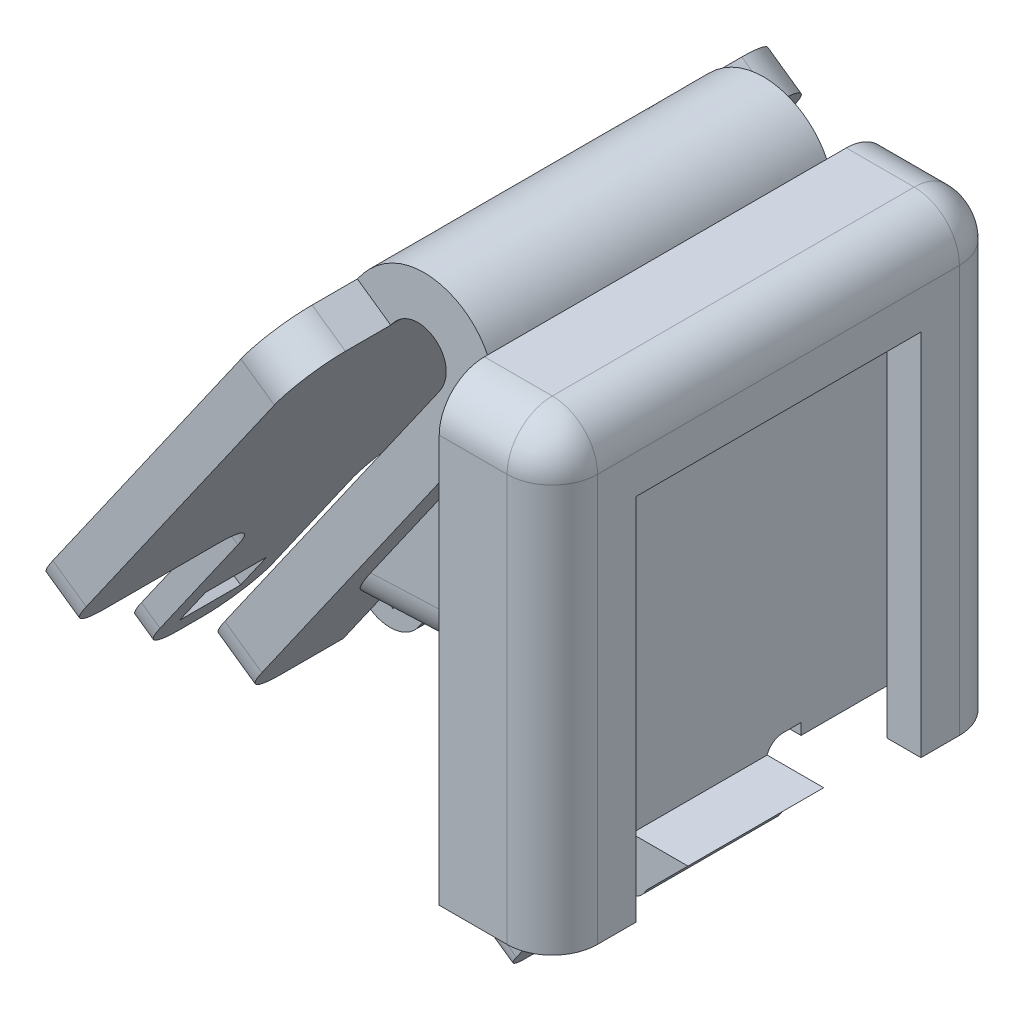
from build123d import *

# Parameters (mm, degrees)
BOSS_EXTRUDE1_DEPTH      = 1.5
FILLET7_R                = 0.75
BOSS_EXTRUDE2_DEPTH      = 2
BOSS_EXTRUDE3_DEPTH      = 1.5
BOSS_EXTRUDE5_DEPTH      = 3
BOSS_EXTRUDE5_DEPTH_BACK = 3
BOSS_EXTRUDE4_DEPTH      = 7.5
BOSS_EXTRUDE4_DEPTH_BACK = 7.5
BOSS_EXTRUDE6_DEPTH      = 1.8
BOSS_EXTRUDE7_DEPTH      = 15
SKETCH18_W               = 1
SKETCH18_H               = 5.5
CUT_EXTRUDE2_DEPTH       = 5
FILLET8_R                = 2
SKETCH14_W               = 2.5
SKETCH14_H               = 1
BOSS_EXTRUDE9_DEPTH      = 1.15
SKETCH16_W               = 2.5
SKETCH16_H               = 3
BOSS_EXTRUDE11_DEPTH     = 1
SKETCH15_W               = 5
SKETCH15_H               = 10
SKETCH15_W_2             = 2.7
SKETCH15_H_2             = 2
BOSS_EXTRUDE10_DEPTH     = 1
FILLET2_R                = 1
FILLET3_R                = 2
FILLET4_R                = 2
FILLET5_R                = 1.55


with BuildPart() as part:
    # Sketch1 → Boss-Extrude1 (new body)
    with BuildSketch(Plane(origin=(0, 0, 0), x_dir=(0, 0, -1), z_dir=(1, 0, 0))):
        Polygon((-10, -10), (-10, 10), (10, 10), (10, -10), (4.5, -10), (4.5, -9.5), (3, -9.5), (3, -10), (-3, -10), (-3, -9.5), (-4.5, -9.5), (-4.5, -10), align=None)
    extrude(amount=BOSS_EXTRUDE1_DEPTH)

    # Fillet7
    # the kernel refuses this fillet: 0.75 mm, written as the material it adds along each edge
    with BuildSketch(Plane(origin=(0, -9.5, -3), x_dir=(0, 0, -1), z_dir=(1, 0, 0))) as fillet7_piece_1:
        with BuildLine():
            CenterArc((0.707106781, -0.75), FILLET7_R, 90, 70.528779366)
            Line((0, -0.5), (-0.014142136, -0.495))
            ThreePointArc((-0.014142136, -0.495), (-0.015, -0.25), (-0.015, 0))
            Line((-0.015, 0), (0, 0.015))
            Line((0, 0.015), (0.707106781, 0.015))
            Line((0.707106781, 0.015), (0.707106781, 0))
        make_face()
    extrude(amount=1.5)
    with BuildSketch(Plane(origin=(0, -9.5, 3), x_dir=(0, -1, 0), z_dir=(1, 0, 0))) as fillet7_piece_2:
        with BuildLine():
            CenterArc((0.75, -0.707106781), FILLET7_R, 109.471220634, 70.528779366)
            Line((0, -0.707106781), (-0.015, -0.707106781))
            Line((-0.015, -0.707106781), (-0.015, 0))
            Line((-0.015, 0), (0, 0.015))
            ThreePointArc((0, 0.015), (0.25, 0.015), (0.495, 0.014142136))
            Line((0.495, 0.014142136), (0.5, 0))
        make_face()
    extrude(amount=1.5)

    # Sketch3 → Boss-Extrude2 (add)
    with BuildSketch(Plane(origin=(1.5, 0, 0), x_dir=(0, 0, -1), z_dir=(1, 0, 0))):
        Polygon((-10, 10), (-10, -10), (-8.5, -10), (-8.5, 8.5), (8.5, 8.5), (8.5, -10), (10, -10), (10, 10), align=None)
    extrude(amount=BOSS_EXTRUDE2_DEPTH)

    # Sketch5 → Boss-Extrude3 (add)
    with BuildSketch(Plane(origin=(3.5, 0, 0), x_dir=(0, 0, -1), z_dir=(1, 0, 0))):
        Polygon((-10, 10), (-10, -10), (-6.3, -10), (-6.3, 6.3), (6.3, 6.3), (6.3, -10), (10, -10), (10, 10), align=None)
    extrude(amount=BOSS_EXTRUDE3_DEPTH)

    # Sketch9 → Boss-Extrude5 (add, two sides: drawn at the far end of the back side and taken through both)
    with BuildSketch(Plane.XY.offset(-BOSS_EXTRUDE5_DEPTH_BACK)):
        Polygon((0, -10), (4, -10), (2.158934381, -11.841065619), (2.158934381, -12.407832924), (-0.169277933, -12.407832924), (-4.161939967, -18.109945249), (-5.800244055, -16.962792376), (-0.924844346, -10), align=None)
    extrude(amount=BOSS_EXTRUDE5_DEPTH + BOSS_EXTRUDE5_DEPTH_BACK)



with BuildPart() as body_2:
    # Sketch6 → Boss-Extrude4 (new, two sides: drawn at the far end of the back side and taken through both)
    with BuildSketch(Plane.XY.offset(-BOSS_EXTRUDE4_DEPTH_BACK)):
        Polygon((-13.124734081, -8.003579973), (-11.486429992, -9.150732846), (-0.875265919, 6.003579973), (-2.513570008, 7.150732846), align=None)
    extrude(amount=BOSS_EXTRUDE4_DEPTH + BOSS_EXTRUDE4_DEPTH_BACK)


with BuildPart() as part_1:
    add(part.part)

    add(body_2.part)  # Loft1 merges body 2
    # Sketch7 → Loft1 section 0
    with BuildSketch(Plane(origin=(-3.408072147, 2.386357808, 0), x_dir=(0, 0, -1), z_dir=(0.8191520442889888, -0.5735764363510506, 0))):
        with BuildLine():
            Line((-6, -8.834187099), (6, -8.834187099))
            Line((6, -8.834187099), (6, 3.165812901))
            Line((6, 3.165812901), (-6, 3.165812901))
            Line((-6, 3.165812901), (-6, -8.834187099))
        make_face()
    # Sketch8 → Loft1 section 1
    with BuildSketch(Plane.ZY):
        with BuildLine():
            Line((-6, -4.5), (6, -4.5))
            Line((6, -4.5), (6, 5.5))
            Line((6, 5.5), (-6, 5.5))
            Line((-6, 5.5), (-6, -4.5))
        make_face()
    loft()



with BuildPart() as body_2_2:
    # Sketch11 → Boss-Extrude6 (new body)
    with BuildSketch(Plane(origin=(-7.176171551, 5.024809415, 0), x_dir=(0, 0, 1), z_dir=(-0.8191520442889889, 0.5735764363510503, 0))):
        Polygon((-11.5, -14.084187099), (-4, -14.084187099), (11.5, -14.084187099), (11.5, 4.415812901), (-11.5, 4.415812901), align=None)
    extrude(amount=BOSS_EXTRUDE6_DEPTH)


with BuildPart() as part_2:
    add(part_1.part)

    add(body_2_2.part)  # Boss-Extrude7 merges body 2 2
    # Sketch12 → Boss-Extrude7 (add)
    with BuildSketch(Plane.XY.offset(7.5)):
        with BuildLine():
            Line((-6.117839003, 9.674469166), (-4.643365323, 8.642031581))
            add(Edge.make_bspline(
                [(-4.643365323, 8.642031581), (-3.504863732, 10.267980359), (-1.377538094, 8.77315456), (-2.513570008, 7.150732846)],
                knots=[0, 0, 0, 0, 1, 1, 1, 1], degree=3))
            Line((-2.513570008, 7.150732846), (-0.875265919, 6.003579973))
            add(Edge.make_bspline(
                [(-6.117839003, 9.674469166), (-3.343598781, 13.636494809), (1.950701407, 10.039479578), (-0.875265919, 6.003579973)],
                knots=[0, 0, 0, 0, 1, 1, 1, 1], degree=3))
        make_face()
    extrude(amount=-BOSS_EXTRUDE7_DEPTH)

    # Sketch18 → Cut-Extrude2 (cut)
    with BuildSketch(Plane(origin=(-8.078357845, -11.537090654, 0), x_dir=(0.8191520442889898, -0.5735764363510492, 0), z_dir=(-0.573576436351049, -0.8191520442889897, 0))):
        with Locations((-4.660487874, 0)):
            Rectangle(SKETCH18_W, SKETCH18_H)
    extrude(amount=-CUT_EXTRUDE2_DEPTH, mode=Mode.SUBTRACT)

    # Fillet8
    # the kernel refuses this fillet: 2 mm, written as the material it adds along each edge
    with BuildSketch(Plane(origin=(-9.437699854, -4.481396188, -7.080127019), x_dir=(0.8191520442889484, -0.5735764363511082, 0), z_dir=(0, 0, 1))) as fillet8_piece_1:
        with BuildLine():
            CenterArc((2, -1.732050808), FILLET8_R, 120, 60)
            Line((0, -1.732050808), (-0.04, -1.732050808))
            Line((-0.04, -1.732050808), (-0.04, 0))
            Line((-0.04, 0), (0, 0.04))
            ThreePointArc((0, 0.04), (0.5, 0.04), (0.98, 0.034641016))
            Line((0.98, 0.034641016), (1, 0))
        make_face()
    extrude(amount=14.160254038)

    # Sketch14 → Boss-Extrude9 (add)
    with BuildSketch(Plane(origin=(-4.227224191, 2.959934244, 0), x_dir=(0, 0, -1), z_dir=(0.8191520442889896, -0.5735764363510492, 0))):
        with Locations((0, -13.584187099)):
            Rectangle(SKETCH14_W, SKETCH14_H)
    extrude(amount=BOSS_EXTRUDE9_DEPTH)

    # Sketch16 → Boss-Extrude11 (add)
    with BuildSketch(Plane(origin=(-3.28519934, 2.300321343, 0), x_dir=(0, 0, -1), z_dir=(0.8191520442889892, -0.5735764363510499, 0))):
        with Locations((0, -12.584187099)):
            Rectangle(SKETCH16_W, SKETCH16_H)
    extrude(amount=BOSS_EXTRUDE11_DEPTH)

    # Sketch15 → Boss-Extrude10 (add)
    with BuildSketch(Plane(origin=(-7.176171551, 5.024809415, 0), x_dir=(0, 0, -1), z_dir=(0.8191520442889889, -0.5735764363510503, 0))):
        with Locations((0, -19.084187099)):
            Rectangle(SKETCH15_W, SKETCH15_H)
        with Locations((0, -21.584187099)):
            Rectangle(SKETCH15_W_2, SKETCH15_H_2, mode=Mode.SUBTRACT)
    extrude(amount=-BOSS_EXTRUDE10_DEPTH)

    # Fillet2
    # the kernel refuses this fillet: 1 mm, written as the material it adds along each edge
    with BuildSketch(Plane(origin=(-0.169277933, -12.407832924, 3), x_dir=(1, 0, 0), z_dir=(0, 0, -1))) as fillet2_piece_1:
        with BuildLine():
            CenterArc((FILLET2_R * 0.520567050552, FILLET2_R), FILLET2_R, 215, 55)
            Line((-FILLET2_R * 0.298584993737, FILLET2_R * 0.426423563649), (0, 0))
            Line((0, 0), (FILLET2_R * 0.520567050552, 0))
        make_face()
    extrude(amount=6)
    # the kernel refuses this fillet: 1 mm, written as the material it takes off along each edge
    with BuildSketch(Plane(origin=(2.158934381, -12.407832924, 5.253205262), x_dir=(0, 1, 0), z_dir=(0, 0, -1))) as fillet2_2_piece_1:
        with BuildLine():
            CenterArc((1, -0.901282105), FILLET2_R, 115.672890719, 64.327109281)
            Line((0, -0.901282105), (0, 0))
            Line((0, 0), (0.566767305, 0))
        make_face()
    extrude(amount=10.506410523, mode=Mode.SUBTRACT)
    with BuildSketch(Plane(origin=(-2.114059856, -19.54388634, -3), x_dir=(0.5735764363510425, 0.8191520442889944, 0), z_dir=(-0.8191520442889945, 0.5735764363510425, 0))) as fillet2_2_piece_2:
        with BuildLine():
            CenterArc((FILLET2_R, -FILLET2_R), FILLET2_R, 90, 90)
            Line((0, -FILLET2_R), (0, 0))
            Line((0, 0), (FILLET2_R, 0))
        make_face()
    extrude(amount=7, mode=Mode.SUBTRACT)
    with BuildSketch(Plane(origin=(-2.114059856, -19.54388634, 3), x_dir=(0.5735764363510425, 0.8191520442889944, 0), z_dir=(-0.8191520442889945, 0.5735764363510425, 0))) as fillet2_2_piece_3:
        with BuildLine():
            CenterArc((FILLET2_R, FILLET2_R), FILLET2_R, 180, 90)
            Line((0, FILLET2_R), (0, 0))
            Line((0, 0), (FILLET2_R, 0))
        make_face()
    extrude(amount=7, mode=Mode.SUBTRACT)
    with BuildSketch(Plane(origin=(-0.924844346, -10, -4.301417626), x_dir=(1, 0, 0), z_dir=(0, 0, 1))) as fillet2_2_piece_4:
        with BuildLine():
            CenterArc((FILLET2_R * 0.520567050552, -FILLET2_R), FILLET2_R, 90, 55)
            Line((-FILLET2_R * 0.298584993737, -FILLET2_R * 0.426423563649), (0, 0))
            Line((0, 0), (FILLET2_R * 0.520567050552, 0))
        make_face()
    extrude(amount=8.602835253, mode=Mode.SUBTRACT)

    # Fillet3
    fillet3_edges = [part_2.edges().sort_by_distance(p)[0] for p in [
        (-21.399869781, -14.417013464, 2.5),
        (-15.664105418, -6.225493021, 2.5),
        (-15.664105418, -6.225493021, -2.5),
        (-21.399869781, -14.417013464, -2.5),
    ]]
    fillet(fillet3_edges, radius=FILLET3_R)

    # Fillet4
    # the kernel refuses this fillet: 2 mm, written as the material it takes off along each edge
    with BuildSketch(Plane(origin=(3, 8, 8), x_dir=(0, 0, 1), z_dir=(0, 1, 0))) as fillet4_piece_1_section:
        Polygon((0, 0), (FILLET4_R * 1.02, 0), (FILLET4_R * 1.02, FILLET4_R * 1.02), (0, FILLET4_R * 1.02), align=None)
    fillet4_piece_1 = extrude(amount=FILLET4_R * 1.02, mode=Mode.PRIVATE)
    fillet4_piece_1 = fillet4_piece_1 - Plane(origin=(3, 8, 8), x_dir=(-0.7071067811865475, 0, -0.7071067811865475), z_dir=(0, 1, 0)) * Sphere(FILLET4_R, mode=Mode.PRIVATE)
    add(fillet4_piece_1, mode=Mode.SUBTRACT)
    with BuildSketch(Plane(origin=(3, 8, -8), x_dir=(0, 0, -1), z_dir=(0, 1, 0))) as fillet4_piece_2_section:
        Polygon((0, 0), (FILLET4_R * 1.02, 0), (FILLET4_R * 1.02, -FILLET4_R * 1.02), (0, -FILLET4_R * 1.02), align=None)
    fillet4_piece_2 = extrude(amount=FILLET4_R * 1.02, mode=Mode.PRIVATE)
    fillet4_piece_2 = fillet4_piece_2 - Plane(origin=(3, 8, -8), x_dir=(-0.7071067811865475, 0, 0.7071067811865475), z_dir=(0, 1, 0)) * Sphere(FILLET4_R, mode=Mode.PRIVATE)
    add(fillet4_piece_2, mode=Mode.SUBTRACT)
    with BuildSketch(Plane(origin=(5, 8, 10), x_dir=(0, 0, -1), z_dir=(0, -1, 0))) as fillet4_piece_3:
        with BuildLine():
            CenterArc((FILLET4_R, -FILLET4_R), FILLET4_R, 90, 90)
            Line((0, -FILLET4_R), (0, 0))
            Line((0, 0), (FILLET4_R, 0))
        make_face()
    extrude(amount=23, mode=Mode.SUBTRACT)
    with BuildSketch(Plane(origin=(5, 10, -8), x_dir=(0, -1, 0), z_dir=(0, 0, 1))) as fillet4_piece_4:
        with BuildLine():
            CenterArc((FILLET4_R, -FILLET4_R), FILLET4_R, 90, 90)
            Line((0, -FILLET4_R), (0, 0))
            Line((0, 0), (FILLET4_R, 0))
        make_face()
    extrude(amount=16, mode=Mode.SUBTRACT)
    with BuildSketch(Plane(origin=(5, -15, -10), x_dir=(-1, 0, 0), z_dir=(0, 1, 0))) as fillet4_piece_5:
        with BuildLine():
            CenterArc((FILLET4_R, FILLET4_R), FILLET4_R, 180, 90)
            Line((0, FILLET4_R), (0, 0))
            Line((0, 0), (FILLET4_R, 0))
        make_face()
    extrude(amount=23, mode=Mode.SUBTRACT)
    with BuildSketch(Plane(origin=(3, 10, -10), x_dir=(0, -1, 0), z_dir=(-1, 0, 0))) as fillet4_piece_6_section:
        with BuildLine():
            CenterArc((FILLET4_R, FILLET4_R), FILLET4_R, 180, 90)
            Line((0, FILLET4_R), (0, 0))
            Line((0, 0), (FILLET4_R, 0))
        make_face()
    fillet4_piece_6 = extrude(amount=8, mode=Mode.PRIVATE)
    fillet4_piece_6 = split(fillet4_piece_6, bisect_by=Plane(origin=(-0.152626661, 5.497582517, -10), z_dir=(0.5735764363510504, 0.8191520442889889, 0)), keep=Keep.TOP, mode=Mode.PRIVATE)
    add(fillet4_piece_6, mode=Mode.SUBTRACT)
    with BuildSketch(Plane(origin=(3, 10, 10), x_dir=(0, 0, -1), z_dir=(-1, 0, 0))) as fillet4_piece_7_section:
        with BuildLine():
            CenterArc((FILLET4_R, FILLET4_R), FILLET4_R, 180, 90)
            Line((0, FILLET4_R), (0, 0))
            Line((0, 0), (FILLET4_R, 0))
        make_face()
    fillet4_piece_7 = extrude(amount=8, mode=Mode.PRIVATE)
    fillet4_piece_7 = split(fillet4_piece_7, bisect_by=Plane(origin=(-0.152626661, 5.497582517, 10), z_dir=(0.5735764363510504, 0.8191520442889889, 0)), keep=Keep.TOP, mode=Mode.PRIVATE)
    add(fillet4_piece_7, mode=Mode.SUBTRACT)
    with BuildSketch(Plane(origin=(-0.547605102, 5.774149399, -11.5), x_dir=(0, 0, 1), z_dir=(-0.8191520442889889, 0.5735764363510504, 0)), Plane(origin=(-11.158769174, -9.380163421, -11.5), x_dir=(0.5735764363510504, 0.8191520442889889, 0), z_dir=(-0.8191520442889889, 0.5735764363510504, 0)), Plane(origin=(-0.547605102, 5.774149399, 11.5), x_dir=(-0.5735764363510504, -0.8191520442889888, 0), z_dir=(-0.8191520442889889, 0.5735764363510504, 0))) as fillet4_piece_8:
        with BuildLine():
            CenterArc((FILLET4_R, -FILLET4_R), FILLET4_R, 90, 90)
            Line((0, -FILLET4_R), (0, 0))
            Line((0, 0), (FILLET4_R, 0))
        make_face()
    extrude(amount=11.8, mode=Mode.SUBTRACT)
    with BuildSketch(Plane(origin=(-11.158769174, -9.380163421, 11.5), x_dir=(0.5735764363510504, 0.8191520442889888, 0), z_dir=(-0.8191520442889889, 0.5735764363510504, 0))) as fillet4_piece_9:
        with BuildLine():
            CenterArc((FILLET4_R, FILLET4_R), FILLET4_R, 180, 90)
            Line((0, FILLET4_R), (0, 0))
            Line((0, 0), (FILLET4_R, 0))
        make_face()
    extrude(amount=11.8, mode=Mode.SUBTRACT)
    with BuildSketch(Plane(origin=(-6.344870663, 3.426427706, -6), x_dir=(0.310642442370597, -0.9505268397041876, 0), z_dir=(0.9505268397041876, 0.310642442370597, 0))) as fillet4_piece_10_section:
        with BuildLine():
            CenterArc((FILLET4_R, -FILLET4_R), FILLET4_R, 90, 90)
            Line((0, -FILLET4_R), (0, 0))
            Line((0, 0), (FILLET4_R, 0))
        make_face()
    fillet4_piece_10 = extrude(amount=11.675109422, mode=Mode.PRIVATE)
    fillet4_piece_10 = split(fillet4_piece_10, bisect_by=Plane(origin=(-3.885576276, 1.704411238, -6), z_dir=(0.8191520442889891, -0.5735764363510499, 0)), keep=Keep.TOP, mode=Mode.PRIVATE)
    fillet4_piece_10 = split(fillet4_piece_10, bisect_by=Plane(origin=(0, 3.426427706, -6), z_dir=(-1, 0, 0)), keep=Keep.TOP, mode=Mode.PRIVATE)
    add(fillet4_piece_10, mode=Mode.SUBTRACT)
    with BuildSketch(Plane(origin=(-6.344870663, 3.426427706, 6), x_dir=(0, 0, -1), z_dir=(0.9505268397041876, 0.3106424423705969, 0))) as fillet4_piece_11_section:
        with BuildLine():
            CenterArc((FILLET4_R, -FILLET4_R), FILLET4_R, 90, 90)
            Line((0, -FILLET4_R), (0, 0))
            Line((0, 0), (FILLET4_R, 0))
        make_face()
    fillet4_piece_11 = extrude(amount=11.675109422, mode=Mode.PRIVATE)
    fillet4_piece_11 = split(fillet4_piece_11, bisect_by=Plane(origin=(-3.885576276, 1.704411238, 6), z_dir=(0.8191520442889891, -0.5735764363510499, 0)), keep=Keep.TOP, mode=Mode.PRIVATE)
    fillet4_piece_11 = split(fillet4_piece_11, bisect_by=Plane(origin=(0, 3.426427706, 6), z_dir=(-1, 0, 0)), keep=Keep.TOP, mode=Mode.PRIVATE)
    add(fillet4_piece_11, mode=Mode.SUBTRACT)
    with BuildSketch(Plane(origin=(-13.470891015, -5.056603329, -6), x_dir=(-0.041283743098950804, 0.9991474628680893, 0), z_dir=(0.9991474628680892, 0.0412837430989508, 0))) as fillet4_piece_12_section:
        with BuildLine():
            CenterArc((FILLET4_R, FILLET4_R), FILLET4_R, 180, 90)
            Line((0, FILLET4_R), (0, 0))
            Line((0, 0), (FILLET4_R, 0))
        make_face()
    fillet4_piece_12 = extrude(amount=18.48238525, mode=Mode.PRIVATE)
    fillet4_piece_12 = split(fillet4_piece_12, bisect_by=Plane(origin=(-10.215686034, -7.335922395, -6), z_dir=(0.8191520442889891, -0.5735764363510499, 0)), keep=Keep.TOP, mode=Mode.PRIVATE)
    fillet4_piece_12 = split(fillet4_piece_12, bisect_by=Plane(origin=(0, -5.056603329, -6), z_dir=(-1, 0, 0)), keep=Keep.TOP, mode=Mode.PRIVATE)
    add(fillet4_piece_12, mode=Mode.SUBTRACT)
    with BuildSketch(Plane(origin=(-13.470891015, -5.056603329, 6), x_dir=(0, 0, -1), z_dir=(0.9991474628680892, 0.0412837430989508, 0))) as fillet4_piece_13_section:
        with BuildLine():
            CenterArc((FILLET4_R, FILLET4_R), FILLET4_R, 180, 90)
            Line((0, FILLET4_R), (0, 0))
            Line((0, 0), (FILLET4_R, 0))
        make_face()
    fillet4_piece_13 = extrude(amount=18.48238525, mode=Mode.PRIVATE)
    fillet4_piece_13 = split(fillet4_piece_13, bisect_by=Plane(origin=(-10.215686034, -7.335922395, 6), z_dir=(0.8191520442889891, -0.5735764363510499, 0)), keep=Keep.TOP, mode=Mode.PRIVATE)
    fillet4_piece_13 = split(fillet4_piece_13, bisect_by=Plane(origin=(0, -5.056603329, 6), z_dir=(-1, 0, 0)), keep=Keep.TOP, mode=Mode.PRIVATE)
    add(fillet4_piece_13, mode=Mode.SUBTRACT)
    with BuildSketch(Plane(origin=(-13.124734081, -8.003579973, -7.5), x_dir=(0.5735764363510486, 0.8191520442889901, 0), z_dir=(0.8191520442889901, -0.5735764363510486, 0)), Plane(origin=(-13.124734081, -8.003579973, 7.5), x_dir=(0, 0, -1), z_dir=(0.8191520442889901, -0.5735764363510486, 0))) as fillet4_piece_14:
        with BuildLine():
            CenterArc((FILLET4_R, FILLET4_R), FILLET4_R, 180, 90)
            Line((0, FILLET4_R), (0, 0))
            Line((0, 0), (FILLET4_R, 0))
        make_face()
    extrude(amount=7, mode=Mode.SUBTRACT)

    # Fillet5
    fillet5_edges = [part_2.edges().sort_by_distance(p)[0] for p in [
        (-10.544405141, -9.810345748, 0),
    ]]
    fillet(fillet5_edges, radius=FILLET5_R)


solid = part_2.part
